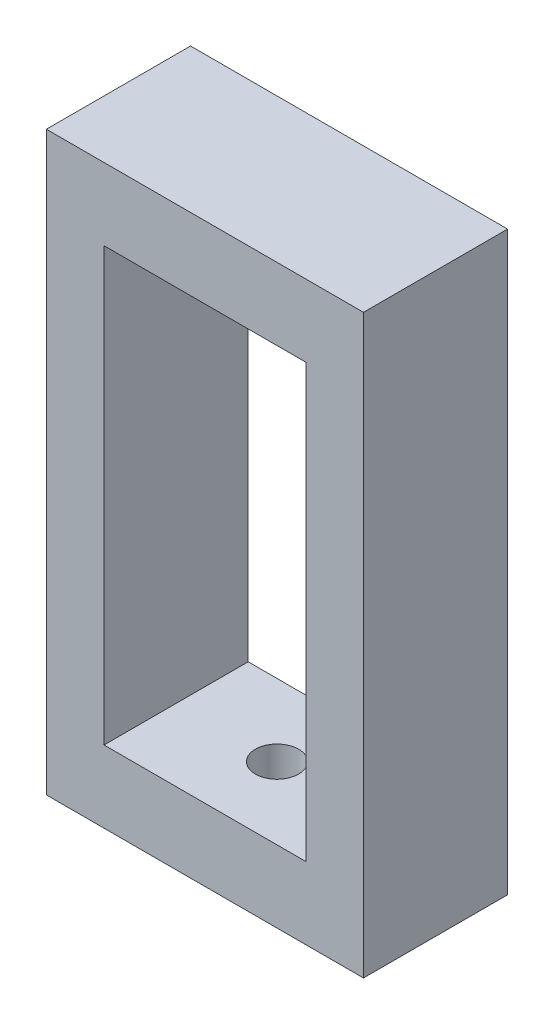
from build123d import *

# Parameters (mm, degrees)
SKETCH1_W           = 22
SKETCH1_H           = 40
SKETCH1_W_2         = 14
SKETCH1_H_2         = 30
BOSS_EXTRUDE1_DEPTH = 10
SKETCH2_R           = 1.5
CUT_EXTRUDE1_DEPTH  = 15


with BuildPart() as part:
    # Sketch1 → Boss-Extrude1 (new body)
    with BuildSketch(Plane.XY):
        with Locations((11, 20)):
            Rectangle(SKETCH1_W, SKETCH1_H)
        with Locations((11, 20)):
            Rectangle(SKETCH1_W_2, SKETCH1_H_2, mode=Mode.SUBTRACT)
    extrude(amount=BOSS_EXTRUDE1_DEPTH)

    # Sketch2 → Cut-Extrude1 (cut, symmetric)
    with BuildSketch(Plane(origin=(0, 0, 0), x_dir=(1, 0, 0), z_dir=(0, 1, 0))):
        with Locations((11, -5)):
            Circle(SKETCH2_R)
    extrude(amount=CUT_EXTRUDE1_DEPTH, both=True, mode=Mode.SUBTRACT)


solid = part.part
